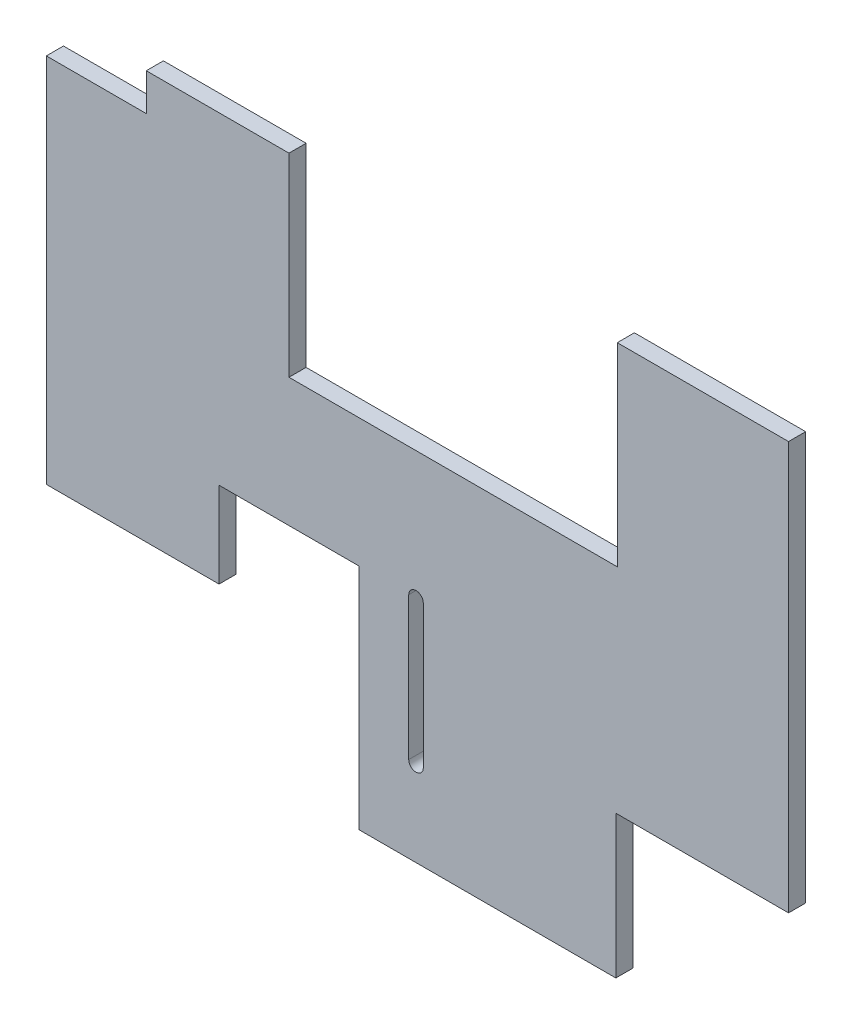
from build123d import *

# Parameters (mm, degrees)
RESSALTO_EXTRUS_O1_DEPTH = 6


with BuildPart() as part:
    # Esboço1 → Ressalto-extrusão1 (new body)
    with BuildSketch(Plane.XY):
        Polygon((-45, 28.5), (-45, 96.5), (-95, 96.5), (-95, 83.5), (-130, 83.5), (-130, -46.5), (-69.5, -46.5), (-69.5, -16.5), (-20.5, -16.5), (-20.5, -96.5), (69.5, -96.5), (69.5, -46.5), (130, -46.5), (130, 96.5), (70, 96.5), (70, 28.5), align=None)
        with BuildLine():
            ThreePointArc((2.05, -66.5), (-0.5, -69.05), (-3.05, -66.5))
            Line((-3.05, -66.5), (-3.05, -16.5))
            ThreePointArc((-3.05, -16.5), (-0.5, -13.95), (2.05, -16.5))
            Line((2.05, -16.5), (2.05, -66.5))
        make_face(mode=Mode.SUBTRACT)
    extrude(amount=RESSALTO_EXTRUS_O1_DEPTH)


solid = part.part
